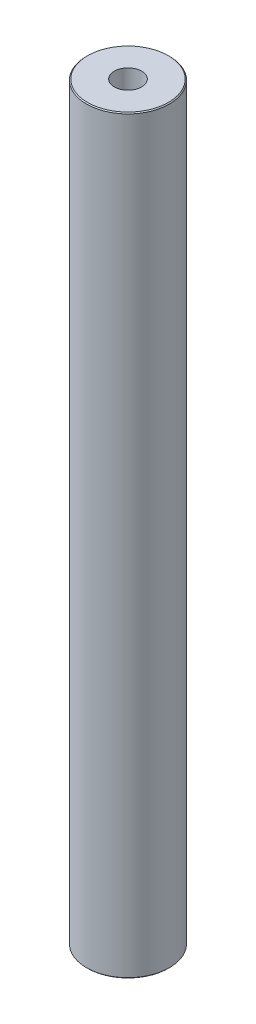
from build123d import *
from OCP.BRepFilletAPI import BRepFilletAPI_MakeChamfer

# Parameters (mm, degrees)
SKETCH1_R           = 12.5
BOSS_EXTRUDE1_DEPTH = 226.231428448
SKETCH2_R           = 4.132090217
CUT_EXTRUDE1_DEPTH  = 227.921041813
CHAMFER1_SIZE       = 0.2899335
CHAMFER1_SIZE2      = 0.291605895


with BuildPart() as part:
    # Sketch1 → Boss-Extrude1 (new body)
    with BuildSketch(Plane(origin=(0, 0, 0), x_dir=(1, 0, 0), z_dir=(0, 1, 0))):
        Circle(SKETCH1_R)
    extrude(amount=BOSS_EXTRUDE1_DEPTH)

    # Sketch2 → Cut-Extrude1 (cut, through all)
    with BuildSketch(Plane(origin=(0, 0, 0), x_dir=(1, 0, 0), z_dir=(0, 1, 0))):
        Circle(SKETCH2_R)
    extrude(amount=CUT_EXTRUDE1_DEPTH, mode=Mode.SUBTRACT)

    # Chamfer1: one chamfer whose edges measure the first distance from different faces: ONE call of the kernel's chamfer builder (chamfer() names one face for all edges)
    chamfer1_edges_1 = [part.edges().sort_by_distance(p)[0] for p in [
        (-12.5, 226.231428448, 0),
    ]]
    chamfer1_side_1 = [part.faces().sort_by_distance(p)[0] for p in [
        (-12.5, 113.115714224, 0),
    ]]
    chamfer1_edges_2 = [part.edges().sort_by_distance(p)[0] for p in [
        (-12.5, 0, 0),
    ]]
    chamfer1_side_2 = [part.faces().sort_by_distance(p)[0] for p in [
        (-12.146446609, 0, 0),
    ]]
    chamfer1 = BRepFilletAPI_MakeChamfer(part.part.solid().wrapped)
    for e in chamfer1_edges_1:
        chamfer1.Add(CHAMFER1_SIZE, CHAMFER1_SIZE2, e.wrapped, chamfer1_side_1[0].wrapped)  # the first distance lies on this face
    for e in chamfer1_edges_2:
        chamfer1.Add(CHAMFER1_SIZE, CHAMFER1_SIZE2, e.wrapped, chamfer1_side_2[0].wrapped)  # the first distance lies on this face
    add(Compound.cast(chamfer1.Shape()), mode=Mode.REPLACE)


solid = part.part
